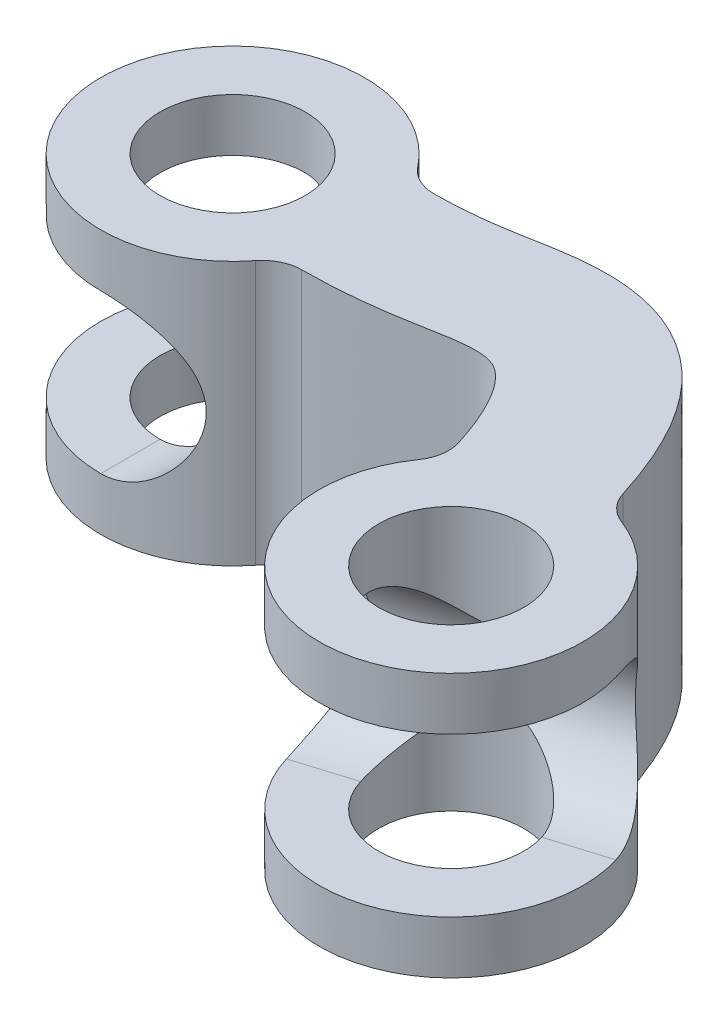
from build123d import *

# Parameters (mm, degrees)
BOSS_EXTRUDE5_DEPTH             = 10
CUT_EXTRUDE9_REACH              = 30.643
SKETCH17_R                      = 2.75
CUT_EXTRUDE10_REACH             = 30.643
CUT_EXTRUDE10_DIRECTION_2_REACH = 30.643
CUT_EXTRUDE11_REACH             = 30.643
CUT_EXTRUDE11_DIRECTION_2_REACH = 30.643
FILLET4_R                       = 1.5


with BuildPart() as part:
    # Sketch10 → Boss-Extrude5 (new body)
    with BuildSketch(Plane(origin=(0, 0, 0), x_dir=(1, 0, 0), z_dir=(0, 1, 0))):
        with BuildLine():
            Line((4.330127019, -2.5), (5, -2.5))
            add(Edge.make_bspline(
                [(5, -2.5), (5.218652416, -2.5), (5.666439808, -2.493697021), (6.477649913, -2.458772224), (7.39909964, -2.378856706), (8.349506279, -2.246726035), (9.428283982, -2.055921538), (10.410709418, -1.866729418), (11.25776784, -1.821616916), (11.758948562, -1.933554086), (12.121696597, -2.136258592), (12.569640284, -2.617926292), (12.962419346, -3.212331181), (13.317495799, -3.946652265), (13.598433763, -4.677217721), (13.743872014, -5.118254359), (13.809180791, -5.331462419)],
                knots=[0, 0, 0, 0, 0.03125, 0.0625, 0.125, 0.1875, 0.25, 0.375, 0.5, 0.625, 0.75, 0.8125, 0.875, 0.9375, 0.96875, 1, 1, 1, 1], degree=3))
            Line((13.809180791, -5.331462419), (14.005374796, -5.971960446))
            ThreePointArc((14.005374796, -5.971960446), (19.128375946, -14.160741149), (18.786117158, -4.507548459))
            Line((18.786117158, -4.507548459), (18.589923153, -3.867050432))
            add(Edge.make_bspline(
                [(5, 2.5), (5.171794591, 2.5), (5.526220239, 2.504997376), (6.147986696, 2.531947066), (6.839064059, 2.591923855), (7.561637444, 2.692106236), (8.463627853, 2.849997888), (9.62577744, 3.077936287), (11.394204051, 3.233163633), (13.577674513, 2.861046774), (15.384300736, 1.739551102), (16.579087627, 0.402148765), (17.355695772, -0.7961095), (17.914626478, -1.967283501), (18.313393704, -3.0079009), (18.503014108, -3.583325797), (18.589923153, -3.867050432)],
                knots=[0, 0, 0, 0, 0.03125, 0.0625, 0.125, 0.1875, 0.25, 0.375, 0.5, 0.625, 0.75, 0.8125, 0.875, 0.9375, 0.96875, 1, 1, 1, 1], degree=3))
            Line((5, 2.5), (4.330127019, 2.5))
            ThreePointArc((4.330127019, 2.5), (-5, 0), (4.330127019, -2.5))
        make_face()
    extrude(amount=BOSS_EXTRUDE5_DEPTH)

    # Sketch17 → Cut-Extrude9 (cut, up to next)
    with BuildSketch(Plane(origin=(0, 0, 0), x_dir=(1, 0, 0), z_dir=(0, 1, 0)), mode=Mode.PRIVATE) as cut_extrude9_sk1:
        Circle(SKETCH17_R)
    cut_extrude9_tool1 = extrude(cut_extrude9_sk1.sketch, amount=CUT_EXTRUDE9_REACH, mode=Mode.PRIVATE) & part.part
    # Sketch17 → Cut-Extrude9 (cut, up to next)
    with BuildSketch(Plane(origin=(0, 0, 0), x_dir=(1, 0, 0), z_dir=(0, 1, 0)), mode=Mode.PRIVATE) as cut_extrude9_sk2:
        with Locations((17.663963959, -9.379998787)):
            Circle(SKETCH17_R)
    cut_extrude9_tool2 = extrude(cut_extrude9_sk2.sketch, amount=CUT_EXTRUDE9_REACH, mode=Mode.PRIVATE) & part.part
    add(cut_extrude9_tool1.solids().sort_by_distance((0, 0, 0))[0], mode=Mode.SUBTRACT)
    add(cut_extrude9_tool2.solids().sort_by_distance((17.663964, 0, 9.379999))[0], mode=Mode.SUBTRACT)

    # Sketch18 → Cut-Extrude10 (cut, up to next)
    with BuildSketch(Plane.XY, mode=Mode.PRIVATE) as cut_extrude10_sk1:
        with BuildLine():
            Line((0, 8), (-5, 8))
            Line((-5, 8), (-5, 2))
            Line((-5, 2), (0, 2))
            ThreePointArc((0, 2), (3, 5), (0, 8))
        make_face()
    cut_extrude10_tool1 = extrude(cut_extrude10_sk1.sketch, amount=-CUT_EXTRUDE10_REACH, mode=Mode.PRIVATE) & part.part
    add(cut_extrude10_tool1.solids().sort_by_distance((-1.291429, 5, 0))[0], mode=Mode.SUBTRACT)

    # Sketch18 → Cut-Extrude10 direction 2 (cut, up to next)
    with BuildSketch(Plane.XY, mode=Mode.PRIVATE) as cut_extrude10_direction_2_sk1:
        with BuildLine():
            Line((0, 8), (-5, 8))
            Line((-5, 8), (-5, 2))
            Line((-5, 2), (0, 2))
            ThreePointArc((0, 2), (3, 5), (0, 8))
        make_face()
    cut_extrude10_direction_2_tool1 = extrude(cut_extrude10_direction_2_sk1.sketch, amount=CUT_EXTRUDE10_DIRECTION_2_REACH, mode=Mode.PRIVATE) & part.part
    add(cut_extrude10_direction_2_tool1.solids().sort_by_distance((-1.291429, 5, 0))[0], mode=Mode.SUBTRACT)

    # Sketch19 → Cut-Extrude11 (cut, up to next)
    with BuildSketch(Plane(origin=(17.663963959, 0, 9.379998787), x_dir=(0.2928823974009398, 0, 0.9561484724103668), z_dir=(-0.9561484724103668, 0, 0.2928823974009398)), mode=Mode.PRIVATE) as cut_extrude11_sk1:
        with BuildLine():
            Line((0, 8), (5, 8))
            Line((5, 8), (5, 2))
            Line((5, 2), (0, 2))
            ThreePointArc((0, 2), (-3, 5), (0, 8))
        make_face()
    cut_extrude11_tool1 = extrude(cut_extrude11_sk1.sketch, amount=-CUT_EXTRUDE11_REACH, mode=Mode.PRIVATE) & part.part
    add(cut_extrude11_tool1.solids().sort_by_distance((18.042201, 5, 10.614796))[0], mode=Mode.SUBTRACT)

    # Sketch19 → Cut-Extrude11 direction 2 (cut, up to next)
    with BuildSketch(Plane(origin=(17.663963959, 0, 9.379998787), x_dir=(0.2928823974009398, 0, 0.9561484724103668), z_dir=(-0.9561484724103668, 0, 0.2928823974009398)), mode=Mode.PRIVATE) as cut_extrude11_direction_2_sk1:
        with BuildLine():
            Line((0, 8), (5, 8))
            Line((5, 8), (5, 2))
            Line((5, 2), (0, 2))
            ThreePointArc((0, 2), (-3, 5), (0, 8))
        make_face()
    cut_extrude11_direction_2_tool1 = extrude(cut_extrude11_direction_2_sk1.sketch, amount=CUT_EXTRUDE11_DIRECTION_2_REACH, mode=Mode.PRIVATE) & part.part
    add(cut_extrude11_direction_2_tool1.solids().sort_by_distance((18.042201, 5, 10.614796))[0], mode=Mode.SUBTRACT)

    # Fillet4
    fillet4_edges = [part.edges().sort_by_distance(p)[0] for p in [
        (18.786117158, 5, 4.507548459),
        (4.330127019, 5, -2.5),
        (4.330127019, 5, 2.5),
        (14.005374796, 5, 5.971960446),
    ]]
    fillet(fillet4_edges, radius=FILLET4_R)


solid = part.part
